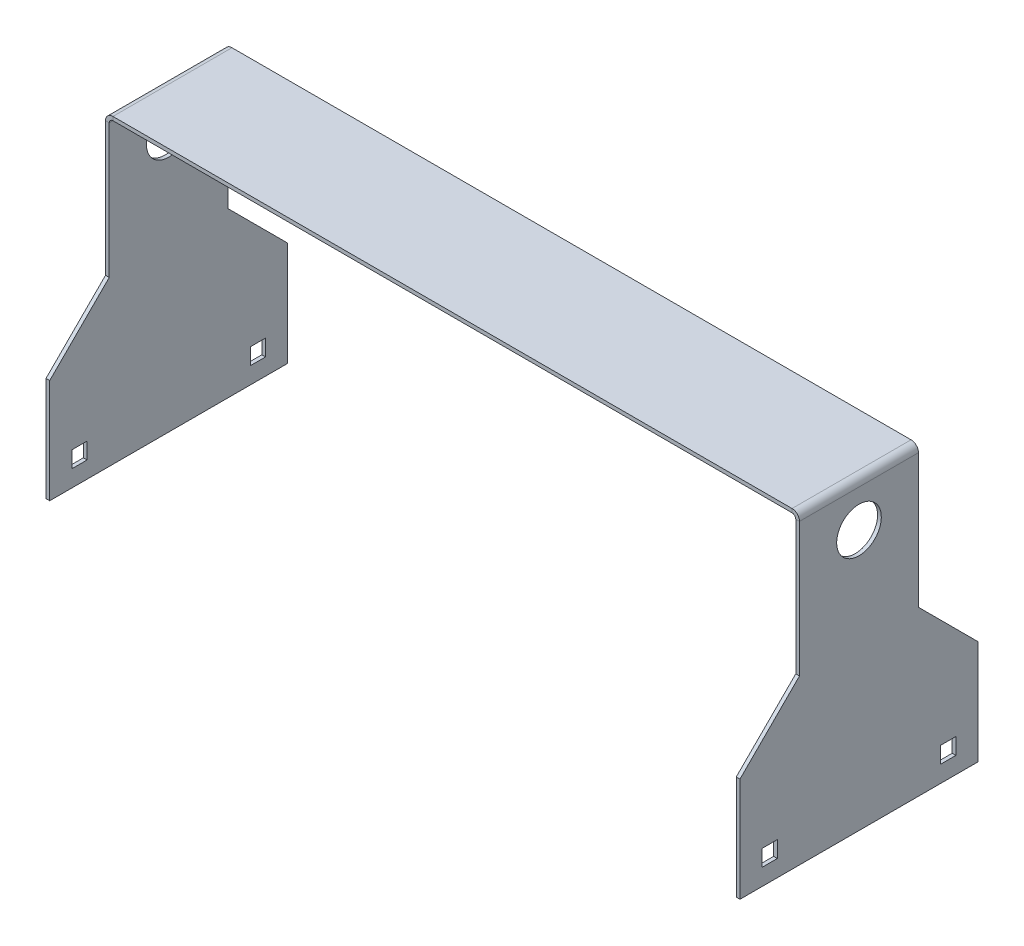
from build123d import *

# Parameters (mm, degrees)
BASE_FLANGE1_START             = -3.175
BASE_FLANGE1_OUTLINE_W         = 1184.91
BASE_FLANGE1_OUTLINE_H         = 203.2
BASE_FLANGE1_DEPTH             = 6.35
EDGE_FLANGE1_STRIP_W           = 48.1
EDGE_FLANGE1_STRIP_H           = 6.35
EDGE_FLANGE1_STRIP_CUT_DEPTH   = 203.2
EDGE_FLANGE1_STRIP_2_W         = 48.1
EDGE_FLANGE1_STRIP_2_H         = 6.35
EDGE_FLANGE1_STRIP_CUT_2_DEPTH = 203.2
EDGE_FLANGE1_DEPTH             = 203.2
EDGE_FLANGE1_BEND_DEPTH        = 203.2
BOSS_EXTRUDE1_START            = -6.35
BOSS_EXTRUDE1_DEPTH            = 6.35
CUT_EXTRUDE1_REACH             = 1310.867
SKETCH13_R                     = 38.1
SKETCH13_W                     = 25.908
SKETCH13_H                     = 27.94
BOSS_EXTRUDE2_DEPTH            = 6.35
MIRROR3_START                  = -165.354
MIRROR3_OUTLINE_W              = 6.35
MIRROR3_OUTLINE_H              = 27.94
MIRROR3_DEPTH                  = 25.908
MIRROR3_START_2                = 139.446
MIRROR3_2_OUTLINE_W            = 6.35
MIRROR3_2_OUTLINE_H            = 27.94
MIRROR3_2_DEPTH                = 25.908


# Read off the part's stored shape, not the designer's step: Base-Flange1, Mirror3
# Sheet-metal steps are written as plain solids
with BuildPart() as part:
    # Base-Flange1 outline → Base-Flange1 (new body)
    with BuildSketch(Plane(origin=(0, 0, 0), x_dir=(1, 0, 0), z_dir=(0, 1, 0)).offset(BASE_FLANGE1_START)):
        Rectangle(BASE_FLANGE1_OUTLINE_W, BASE_FLANGE1_OUTLINE_H)
    extrude(amount=BASE_FLANGE1_DEPTH)

    # Edge-Flange1 strip (across the edge) → Edge-Flange1 strip cut (cut)
    with BuildSketch(Plane(origin=(592.455, -3.175, -101.6), x_dir=(-1, 0, 0), z_dir=(0, 0, 1))):
        with Locations((-11.35, -3.175)):
            Rectangle(EDGE_FLANGE1_STRIP_W, EDGE_FLANGE1_STRIP_H)
    extrude(amount=EDGE_FLANGE1_STRIP_CUT_DEPTH, mode=Mode.SUBTRACT)

    # Edge-Flange1 strip 2 (across the edge) → Edge-Flange1 strip cut 2 (cut)
    with BuildSketch(Plane(origin=(-592.455, -3.175, 101.6), x_dir=(1, 0, 0), z_dir=(0, 0, -1))):
        with Locations((-11.35, -3.175)):
            Rectangle(EDGE_FLANGE1_STRIP_2_W, EDGE_FLANGE1_STRIP_2_H)
    extrude(amount=EDGE_FLANGE1_STRIP_CUT_2_DEPTH, mode=Mode.SUBTRACT)

    # Edge-Flange1 section (across the edge) → Edge-Flange1 (add)
    with BuildSketch(Plane(origin=(592.455, -3.175, -101.6), x_dir=(-1, 0, 0), z_dir=(0, 0, 1))):
        with BuildLine():
            Line((0, 6.35), (0, 514.35))
            Line((0, 514.35), (6.35, 514.35))
            Line((6.35, 514.35), (6.35, 6.35))
            ThreePointArc((6.35, 6.35), (8.209871939, 1.859871939), (12.7, 0))
            Line((12.7, 0), (12.7, -6.35))
            ThreePointArc((12.7, -6.35), (3.719743879, -2.630256121), (0, 6.35))
        make_face()
    extrude(amount=EDGE_FLANGE1_DEPTH)

    # Edge-Flange1 section 2 (across the edge) → Edge-Flange1 bend (add)
    with BuildSketch(Plane(origin=(-592.455, -3.175, 101.6), x_dir=(1, 0, 0), z_dir=(0, 0, -1))):
        with BuildLine():
            Line((0, 6.35), (0, 514.35))
            Line((0, 514.35), (6.35, 514.35))
            Line((6.35, 514.35), (6.35, 6.35))
            ThreePointArc((6.35, 6.35), (8.209871939, 1.859871939), (12.7, 0))
            Line((12.7, 0), (12.7, -6.35))
            ThreePointArc((12.7, -6.35), (3.719743879, -2.630256121), (0, 6.35))
        make_face()
    extrude(amount=EDGE_FLANGE1_BEND_DEPTH)

    # Sketch12 → Boss-Extrude1 (add)
    with BuildSketch(Plane(origin=(592.455, 0, 0), x_dir=(0, 0, -1), z_dir=(1, 0, 0)).offset(BOSS_EXTRUDE1_START)):
        Polygon((-101.6, -238.125), (-203.2, -339.725), (-203.2, -517.525), (-101.6, -517.525), align=None)
        Polygon((203.2, -339.725), (101.6, -238.125), (101.6, -517.525), (203.2, -517.525), align=None)
    extrude(amount=BOSS_EXTRUDE1_DEPTH)

    # Sketch13 → Cut-Extrude1 (cut, up to next)
    with BuildSketch(Plane(origin=(592.455, 0, 0), x_dir=(0, 0, -1), z_dir=(1, 0, 0)), mode=Mode.PRIVATE) as cut_extrude1_sk1:
        with Locations(Location((0, -73.025, 0), (0, 0, 90))):
            Circle(SKETCH13_R)
    cut_extrude1_tool1 = extrude(cut_extrude1_sk1.sketch, amount=-CUT_EXTRUDE1_REACH, mode=Mode.PRIVATE) & part.part
    # Sketch13 → Cut-Extrude1 (cut, up to next)
    with BuildSketch(Plane(origin=(592.455, 0, 0), x_dir=(0, 0, -1), z_dir=(1, 0, 0)), mode=Mode.PRIVATE) as cut_extrude1_sk2:
        with Locations((152.4, -475.107)):
            Rectangle(SKETCH13_W, SKETCH13_H)
    cut_extrude1_tool2 = extrude(cut_extrude1_sk2.sketch, amount=-CUT_EXTRUDE1_REACH, mode=Mode.PRIVATE) & part.part
    # Sketch13 → Cut-Extrude1 (cut, up to next)
    with BuildSketch(Plane(origin=(592.455, 0, 0), x_dir=(0, 0, -1), z_dir=(1, 0, 0)), mode=Mode.PRIVATE) as cut_extrude1_sk3:
        with Locations((-152.4, -475.107)):
            Rectangle(SKETCH13_W, SKETCH13_H)
    cut_extrude1_tool3 = extrude(cut_extrude1_sk3.sketch, amount=-CUT_EXTRUDE1_REACH, mode=Mode.PRIVATE) & part.part
    cut_extrude1_1 = cut_extrude1_tool1.solids().sort_by_distance((592.455, -73.025, 0))[0]
    add(cut_extrude1_1, mode=Mode.SUBTRACT)
    cut_extrude1_2 = cut_extrude1_tool2.solids().sort_by_distance((592.455, -475.107, -152.4))[0]
    add(cut_extrude1_2, mode=Mode.SUBTRACT)
    cut_extrude1_3 = cut_extrude1_tool3.solids().sort_by_distance((592.455, -475.107, 152.4))[0]
    add(cut_extrude1_3, mode=Mode.SUBTRACT)
    cut_extrude1 = cut_extrude1_1 + cut_extrude1_2 + cut_extrude1_3  # Cut-Extrude1 as one shape, for the pattern or mirror that repeats it

    # Mirror1: Cut-Extrude1 across plane
    add(cut_extrude1.mirror(Plane(origin=(0, 0, 0), x_dir=(0, 0, 1), z_dir=(1, 0, 0))), mode=Mode.SUBTRACT)

    # Sketch14 → Boss-Extrude2 (add)
    with BuildSketch(Plane.ZY.offset(592.455)):
        Polygon((203.2, -517.525), (203.2, -339.725), (101.6, -238.125), (-101.6, -238.125), (-203.2, -339.725), (-203.2, -517.525), align=None)
    extrude(amount=-BOSS_EXTRUDE2_DEPTH)

    # Mirror3 outline → Mirror3 (cut)
    with BuildSketch(Plane.XY.offset(MIRROR3_START)):
        with Locations((-589.28, -475.107)):
            Rectangle(MIRROR3_OUTLINE_W, MIRROR3_OUTLINE_H)
    extrude(amount=MIRROR3_DEPTH, mode=Mode.SUBTRACT)

    # Mirror3 2 outline → Mirror3 2 (cut)
    with BuildSketch(Plane.XY.offset(MIRROR3_START_2)):
        with Locations((-589.28, -475.107)):
            Rectangle(MIRROR3_2_OUTLINE_W, MIRROR3_2_OUTLINE_H)
    extrude(amount=MIRROR3_2_DEPTH, mode=Mode.SUBTRACT)


solid = part.part
